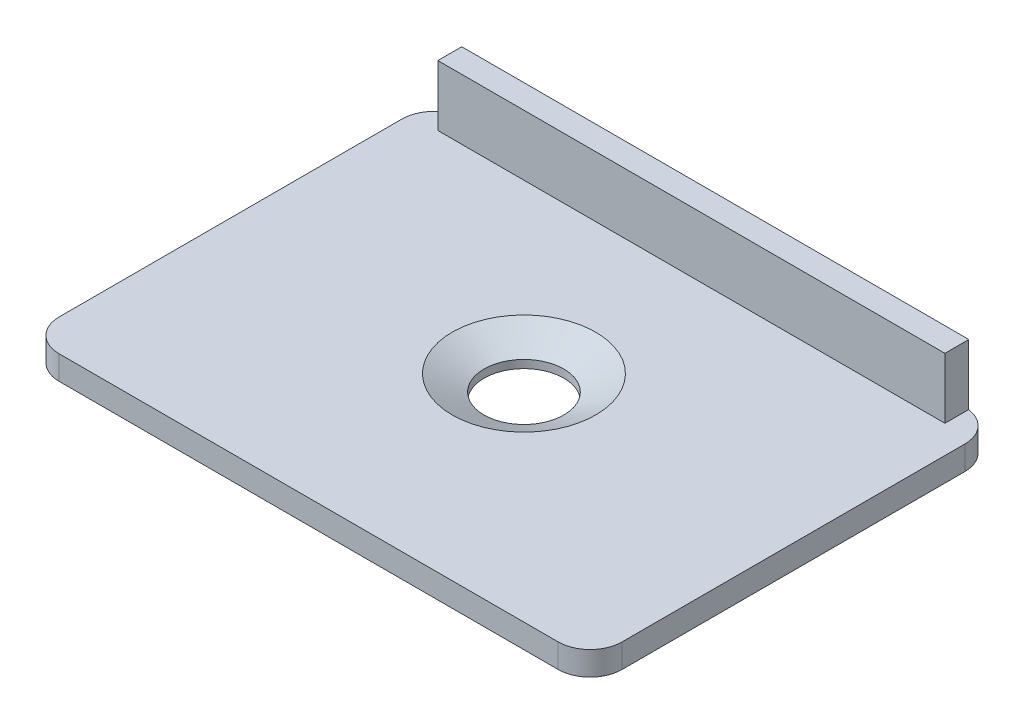
from build123d import *

# Parameters (mm, degrees)
SKETCH1_W               = 35.3
SKETCH1_H               = 25.5
BOSS_EXTRUDE1_DEPTH     = 1.5
SKETCH2_W               = 31.8
SKETCH2_H               = 1.5
BOSS_EXTRUDE2_DEPTH     = 3.8
CUT_EXTRUDE1_DEPTH      = 23.102601657
CUT_EXTRUDE1_DEPTH_BACK = 23.102601657
SKETCH3_R               = 2.5
CHAMFER1_SIZE           = 2
CHAMFER1_SIZE2          = 1
FILLET1_R               = 2


with BuildPart() as part:
    # Sketch1 → Boss-Extrude1 (new body)
    with BuildSketch(Plane(origin=(0, 0, 0), x_dir=(1, 0, 0), z_dir=(0, 1, 0))):
        Rectangle(SKETCH1_W, SKETCH1_H)
    extrude(amount=BOSS_EXTRUDE1_DEPTH)

    # Sketch2 → Boss-Extrude2 (add)
    with BuildSketch(Plane(origin=(0, 1.5, 0), x_dir=(1, 0, 0), z_dir=(0, 1, 0))):
        with Locations((0, 12)):
            Rectangle(SKETCH2_W, SKETCH2_H)
    extrude(amount=BOSS_EXTRUDE2_DEPTH)

    # Sketch3 → Cut-Extrude1 (cut, two sides: drawn at the far end of the back side and taken through both)
    with BuildSketch(Plane(origin=(0, 1.5, 0), x_dir=(1, 0, 0), z_dir=(0, 1, 0)).offset(-CUT_EXTRUDE1_DEPTH_BACK)):
        with Locations((0, 0.75)):
            Circle(SKETCH3_R)
    extrude(amount=CUT_EXTRUDE1_DEPTH + CUT_EXTRUDE1_DEPTH_BACK, mode=Mode.SUBTRACT)

    # Chamfer1
    chamfer1_edges = [part.edges().sort_by_distance(p)[0] for p in [
        (-2.5, 1.5, -0.75),
    ]]
    chamfer1_side = [part.faces().sort_by_distance(p)[0] for p in [
        (-17.214530139, 1.5, 0),
    ]]
    chamfer(chamfer1_edges, length=CHAMFER1_SIZE, length2=CHAMFER1_SIZE2, reference=chamfer1_side[0])

    # Fillet1
    fillet1_edges = [part.edges().sort_by_distance(p)[0] for p in [
        (17.65, 0.75, -12.75),
        (-17.65, 0.75, -12.75),
        (-17.65, 0.75, 12.75),
        (17.65, 0.75, 12.75),
    ]]
    fillet(fillet1_edges, radius=FILLET1_R)


solid = part.part
